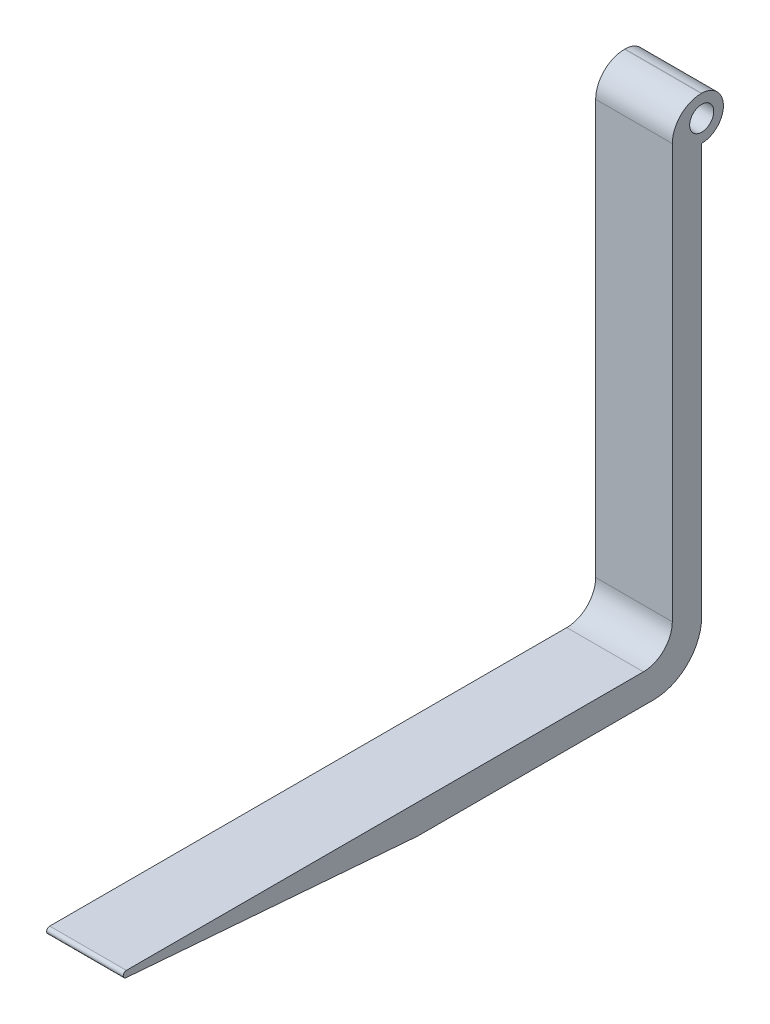
from build123d import *

# Parameters (mm, degrees)
SKETCH1_R           = 25
BOSS_EXTRUDE1_DEPTH = 159
FILLET1_R           = 60
FILLET2_R           = 60
FILLET3_R           = 100
FILLET4_R           = 6.498072


with BuildPart() as part:
    # Sketch1 → Boss-Extrude1 (new body)
    with BuildSketch(Plane(origin=(0, 0, 0), x_dir=(0, 0, -1), z_dir=(1, 0, 0))):
        with BuildLine():
            Line((577.5, 430), (577.5, -520))
            Line((577.5, -520), (-12.5, -520))
            Line((-12.5, -520), (-622.5, -471.5))
            Line((-622.5, -471.5), (-622.5, -459))
            Line((-622.5, -459), (516.5, -459))
            Line((516.5, -459), (516.5, 430))
            Line((516.5, 430), (516.5, 520))
            Line((516.5, 520), (577.5, 520))
            ThreePointArc((577.5, 520), (622.5, 475), (577.5, 430))
        make_face()
        with Locations(Location((577.5, 475, 0), (0, 0, 180))):
            Circle(SKETCH1_R, mode=Mode.SUBTRACT)
    extrude(amount=BOSS_EXTRUDE1_DEPTH)

    # Fillet1
    fillet1_edges = [part.edges().sort_by_distance(p)[0] for p in [
        (79.5, 520, -516.5),
    ]]
    fillet(fillet1_edges, radius=FILLET1_R)

    # Fillet2
    fillet2_edges = [part.edges().sort_by_distance(p)[0] for p in [
        (79.5, -459, -516.5),
    ]]
    fillet(fillet2_edges, radius=FILLET2_R)

    # Fillet3
    fillet3_edges = [part.edges().sort_by_distance(p)[0] for p in [
        (79.5, -520, -577.5),
    ]]
    fillet(fillet3_edges, radius=FILLET3_R)

    # Fillet4
    fillet4_edges = [part.edges().sort_by_distance(p)[0] for p in [
        (79.5, -471.5, 622.5),
        (79.5, -459, 622.5),
    ]]
    fillet(fillet4_edges, radius=FILLET4_R - 0.0001)  # a hair under: the kernel refuses the full size


solid = part.part
